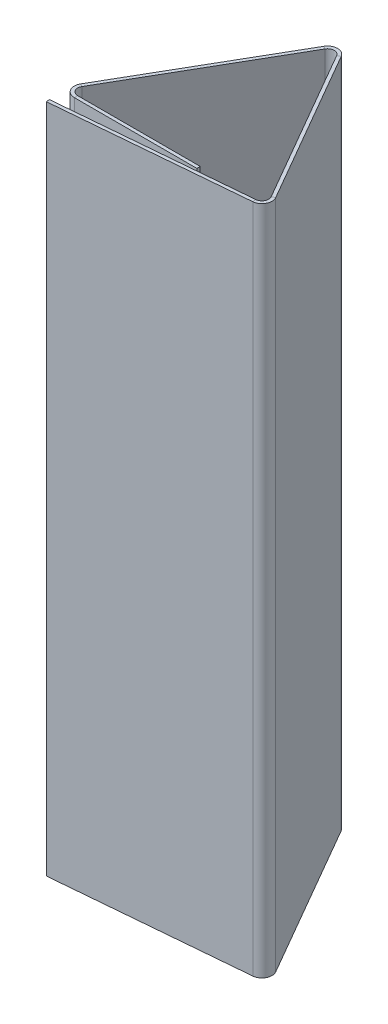
from build123d import *

# Parameters (mm, degrees)
BASE_FLANGE2_DEPTH = 50


# Sheet-metal steps are written as plain solids
with BuildPart() as part:
    # Sketch1 → Base-Flange2 (new body)
    with BuildSketch(Plane(origin=(0, 0, 0), x_dir=(1, 0, 0), z_dir=(0, 1, 0))):
        with BuildLine():
            Line((10, 0), (0.866025404, 0))
            ThreePointArc((0.866025404, 0), (0.433012702, 0.25), (0.433012702, 0.75))
            Line((0.433012702, 0.75), (7.066987298, 12.240381057))
            ThreePointArc((7.066987298, 12.240381057), (7.5, 12.490381057), (7.933012702, 12.240381057))
            Line((7.933012702, 12.240381057), (14.607578606, 0.679693793))
            ThreePointArc((14.607578606, 0.679693793), (14.61807132, 0.198819486), (14.218143775, -0.068403556))
            Line((14.218143775, -0.068403556), (0.057079529, -1.307336141))
            Line((0.057079529, -1.307336141), (0.078868464, -1.556384816))
            Line((0.078868464, -1.556384816), (14.239932711, -0.317452231))
            ThreePointArc((14.239932711, -0.317452231), (14.839824029, 0.083382333), (14.824084957, 0.804693793))
            Line((14.824084957, 0.804693793), (8.149519053, 12.365381057))
            ThreePointArc((8.149519053, 12.365381057), (7.5, 12.740381057), (6.850480947, 12.365381057))
            Line((6.850480947, 12.365381057), (0.216506351, 0.875))
            ThreePointArc((0.216506351, 0.875), (0.216506351, 0.125), (0.866025404, -0.25))
            Line((0.866025404, -0.25), (10, -0.25))
            Line((10, -0.25), (10, 0))
        make_face()
    extrude(amount=BASE_FLANGE2_DEPTH)


solid = part.part
